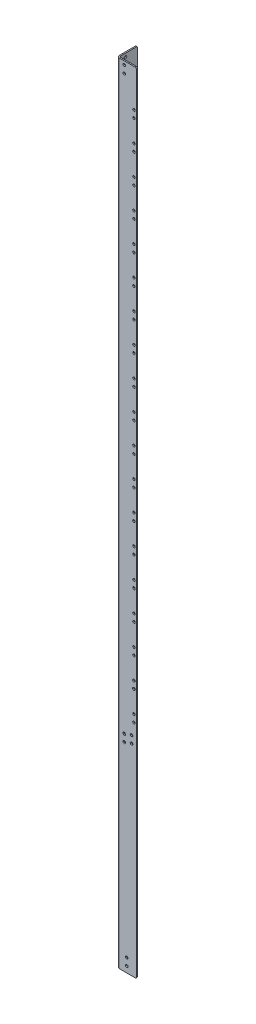
from build123d import *

# Parameters (mm, degrees)
BASE_FLANGE1_DEPTH = 2070.1
CUT_EXTRUDE1_DEPTH = 3.175
SKETCH3_R          = 3.429
SKETCH3_R_2        = 3.175
CUT_EXTRUDE2_DEPTH = 3.175
SKETCH4_R          = 3.429
SKETCH4_R_2        = 3.175
CUT_EXTRUDE3_DEPTH = 3.175
FILLET1_R          = 3.175


# Sheet-metal steps are written as plain solids
with BuildPart() as part:
    # Sketch1 → Base-Flange1 (new body)
    with BuildSketch(Plane(origin=(0, 0, 0), x_dir=(1, 0, 0), z_dir=(0, 1, 0))):
        with BuildLine():
            Line((50.8, 0), (6.35, 0))
            ThreePointArc((6.35, 0), (1.859871939, 1.859871939), (0, 6.35))
            Line((0, 6.35), (0, 50.8))
            Line((0, 50.8), (3.175, 50.8))
            Line((3.175, 50.8), (3.175, 6.35))
            ThreePointArc((3.175, 6.35), (4.10493597, 4.10493597), (6.35, 3.175))
            Line((6.35, 3.175), (50.8, 3.175))
            Line((50.8, 3.175), (50.8, 0))
        make_face()
    extrude(amount=BASE_FLANGE1_DEPTH)

    # Sketch2 → Cut-Extrude1 (cut)
    with BuildSketch(Plane(origin=(0, 2070.1, 0), x_dir=(1, 0, 0), z_dir=(0, 1, 0))):
        Polygon((6.35, 0), (0, 0), (0, 50.8), (6.35, 50.8), (6.35, 3.175), (50.8, 3.175), (50.8, 0), align=None)
    extrude(amount=-CUT_EXTRUDE1_DEPTH, mode=Mode.SUBTRACT)

    # Sketch3 → Cut-Extrude2 (cut)
    with BuildSketch(Plane.XY):
        with Locations((19.05, 2057.4)):
            Circle(SKETCH3_R)
        with Locations((19.05, 2038.35)):
            Circle(SKETCH3_R)
        with Locations((44.45, 1968.5)):
            Circle(SKETCH3_R_2)
        with Locations((44.45, 1949.45)):
            Circle(SKETCH3_R_2)
        with Locations((44.45, 1892.3)):
            Circle(SKETCH3_R_2)
        with Locations((44.45, 1873.25)):
            Circle(SKETCH3_R_2)
        with Locations((44.45, 1816.1)):
            Circle(SKETCH3_R_2)
        with Locations((44.45, 1797.05)):
            Circle(SKETCH3_R_2)
        with Locations((44.45, 1739.9)):
            Circle(SKETCH3_R_2)
        with Locations((44.45, 1720.85)):
            Circle(SKETCH3_R_2)
        with Locations((44.45, 1663.7)):
            Circle(SKETCH3_R_2)
        with Locations((44.45, 1644.65)):
            Circle(SKETCH3_R_2)
        with Locations((44.45, 1587.5)):
            Circle(SKETCH3_R_2)
        with Locations((44.45, 1568.45)):
            Circle(SKETCH3_R_2)
        with Locations((44.45, 1511.3)):
            Circle(SKETCH3_R_2)
        with Locations((44.45, 1492.25)):
            Circle(SKETCH3_R_2)
        with Locations((44.45, 1435.1)):
            Circle(SKETCH3_R_2)
        with Locations((44.45, 1416.05)):
            Circle(SKETCH3_R_2)
        with Locations((44.45, 1358.9)):
            Circle(SKETCH3_R_2)
        with Locations((44.45, 1339.85)):
            Circle(SKETCH3_R_2)
        with Locations((44.45, 1282.7)):
            Circle(SKETCH3_R_2)
        with Locations((44.45, 1263.65)):
            Circle(SKETCH3_R_2)
        with Locations((44.45, 1206.5)):
            Circle(SKETCH3_R_2)
        with Locations((44.45, 1187.45)):
            Circle(SKETCH3_R_2)
        with Locations((44.45, 1130.3)):
            Circle(SKETCH3_R_2)
        with Locations((44.45, 1111.25)):
            Circle(SKETCH3_R_2)
        with Locations((44.45, 1054.1)):
            Circle(SKETCH3_R_2)
        with Locations((44.45, 1035.05)):
            Circle(SKETCH3_R_2)
        with Locations((44.45, 977.9)):
            Circle(SKETCH3_R_2)
        with Locations((44.45, 958.85)):
            Circle(SKETCH3_R_2)
        with Locations((44.45, 901.7)):
            Circle(SKETCH3_R_2)
        with Locations((44.45, 882.65)):
            Circle(SKETCH3_R_2)
        with Locations((44.45, 825.5)):
            Circle(SKETCH3_R_2)
        with Locations((44.45, 806.45)):
            Circle(SKETCH3_R_2)
        with Locations((44.45, 749.3)):
            Circle(SKETCH3_R_2)
        with Locations((44.45, 730.25)):
            Circle(SKETCH3_R_2)
        with Locations((44.45, 596.9)):
            Circle(SKETCH3_R_2)
        with Locations((44.45, 577.85)):
            Circle(SKETCH3_R_2)
        with Locations((38.1, 546.1)):
            Circle(SKETCH3_R)
        with Locations((44.45, 673.1)):
            Circle(SKETCH3_R)
        with Locations((44.45, 654.05)):
            Circle(SKETCH3_R)
        with Locations((19.05, 539.75)):
            Circle(SKETCH3_R)
        with Locations((19.05, 520.7)):
            Circle(SKETCH3_R)
        with Locations((25.4, 15.875)):
            Circle(SKETCH3_R)
        with Locations((25.4, 34.925)):
            Circle(SKETCH3_R)
        with Locations((38.1, 527.05)):
            Circle(SKETCH3_R)
    extrude(amount=-CUT_EXTRUDE2_DEPTH, mode=Mode.SUBTRACT)

    # Sketch4 → Cut-Extrude3 (cut)
    with BuildSketch(Plane.ZY):
        with Locations((-19.05, 2057.4)):
            Circle(SKETCH4_R)
        with Locations((-19.05, 2038.35)):
            Circle(SKETCH4_R)
        with Locations((-44.45, 1968.5)):
            Circle(SKETCH4_R_2)
        with Locations((-44.45, 1949.45)):
            Circle(SKETCH4_R_2)
        with Locations((-44.45, 600.075)):
            Circle(SKETCH4_R_2)
        with Locations((-44.45, 581.025)):
            Circle(SKETCH4_R_2)
        with Locations((-38.1, 546.1)):
            Circle(SKETCH4_R)
        with Locations((-19.05, 539.75)):
            Circle(SKETCH4_R)
        with Locations((-44.45, 1873.25)):
            Circle(SKETCH4_R_2)
        with Locations((-44.45, 1892.3)):
            Circle(SKETCH4_R_2)
        with Locations((-44.45, 1797.05)):
            Circle(SKETCH4_R_2)
        with Locations((-44.45, 1816.1)):
            Circle(SKETCH4_R_2)
        with Locations((-44.45, 1720.85)):
            Circle(SKETCH4_R_2)
        with Locations((-44.45, 1739.9)):
            Circle(SKETCH4_R_2)
        with Locations((-44.45, 1644.65)):
            Circle(SKETCH4_R_2)
        with Locations((-44.45, 1663.7)):
            Circle(SKETCH4_R_2)
        with Locations((-44.45, 1568.45)):
            Circle(SKETCH4_R_2)
        with Locations((-44.45, 1587.5)):
            Circle(SKETCH4_R_2)
        with Locations((-44.45, 1492.25)):
            Circle(SKETCH4_R_2)
        with Locations((-44.45, 1511.3)):
            Circle(SKETCH4_R_2)
        with Locations((-44.45, 1416.05)):
            Circle(SKETCH4_R_2)
        with Locations((-44.45, 1435.1)):
            Circle(SKETCH4_R_2)
        with Locations((-44.45, 1339.85)):
            Circle(SKETCH4_R_2)
        with Locations((-44.45, 1358.9)):
            Circle(SKETCH4_R_2)
        with Locations((-44.45, 1263.65)):
            Circle(SKETCH4_R_2)
        with Locations((-44.45, 1282.7)):
            Circle(SKETCH4_R_2)
        with Locations((-44.45, 1187.45)):
            Circle(SKETCH4_R_2)
        with Locations((-44.45, 1206.5)):
            Circle(SKETCH4_R_2)
        with Locations((-44.45, 1111.25)):
            Circle(SKETCH4_R_2)
        with Locations((-44.45, 1130.3)):
            Circle(SKETCH4_R_2)
        with Locations((-44.45, 1035.05)):
            Circle(SKETCH4_R_2)
        with Locations((-44.45, 1054.1)):
            Circle(SKETCH4_R_2)
        with Locations((-44.45, 958.85)):
            Circle(SKETCH4_R_2)
        with Locations((-44.45, 977.9)):
            Circle(SKETCH4_R_2)
        with Locations((-44.45, 882.65)):
            Circle(SKETCH4_R_2)
        with Locations((-44.45, 901.7)):
            Circle(SKETCH4_R_2)
        with Locations((-44.45, 806.45)):
            Circle(SKETCH4_R_2)
        with Locations((-44.45, 825.5)):
            Circle(SKETCH4_R_2)
        with Locations((-44.45, 730.25)):
            Circle(SKETCH4_R_2)
        with Locations((-44.45, 749.3)):
            Circle(SKETCH4_R_2)
        with Locations((-44.45, 654.05)):
            Circle(SKETCH4_R_2)
        with Locations((-44.45, 673.1)):
            Circle(SKETCH4_R_2)
        with Locations((-19.05, 520.7)):
            Circle(SKETCH4_R)
        with Locations((-25.4, 34.925)):
            Circle(SKETCH4_R)
        with Locations((-25.4, 15.875)):
            Circle(SKETCH4_R)
        with Locations((-38.1, 527.05)):
            Circle(SKETCH4_R)
    extrude(amount=-CUT_EXTRUDE3_DEPTH, mode=Mode.SUBTRACT)

    # Fillet1
    fillet1_edges = [part.edges().sort_by_distance(p)[0] for p in [
        (1.5875, 2066.925, -50.8),
        (50.8, 2066.925, -1.5875),
        (1.5875, 0, -50.8),
        (50.8, 0, -1.5875),
    ]]
    fillet(fillet1_edges, radius=FILLET1_R)


solid = part.part
